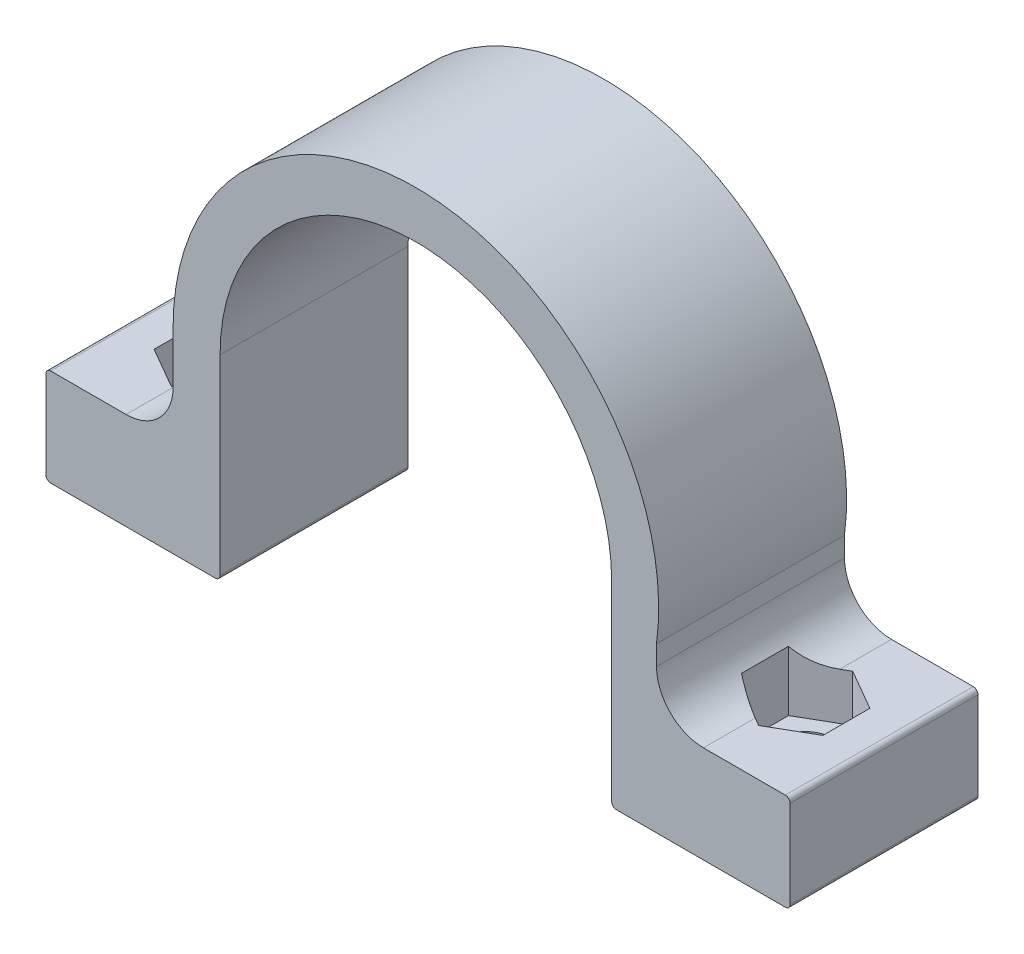
from build123d import *

# Parameters (mm, degrees)
BOSS_EXTRUDE1_DEPTH = 12
SKETCH2_R           = 1.65
CUT_EXTRUDE1_DEPTH  = 35.49487292
CUT_EXTRUDE2_DEPTH  = 3
FILLET2_R           = 3
FILLET3_R           = 0.3


with BuildPart() as part:
    # Sketch1 → Boss-Extrude1 (new body)
    with BuildSketch(Plane.XY):
        with BuildLine():
            Line((-12.5, -12.5), (-12.5, 0))
            ThreePointArc((-12.5, 0), (0, 12.5), (12.5, 0))
            Line((12.5, 0), (12.5, -12.5))
            Line((12.5, -12.5), (23.888412626, -12.5))
            Line((23.888412626, -12.5), (23.888412626, -6.3))
            Line((23.888412626, -6.3), (15.363999686, -6.3))
            Line((15.363999686, -6.3), (15.363999686, -2.048783456))
            ThreePointArc((15.363999686, -2.048783456), (1.026646207, 15.465962549), (-15.5, 0))
            Line((-15.5, 0), (-15.5, -6.3))
            Line((-15.5, -6.3), (-23.612861565, -6.3))
            Line((-23.612861565, -6.3), (-23.612861565, -12.5))
            Line((-23.612861565, -12.5), (-12.5, -12.5))
        make_face()
    extrude(amount=BOSS_EXTRUDE1_DEPTH)

    # Sketch2 → Cut-Extrude1 (cut, through all)
    with BuildSketch(Plane(origin=(0, -6.3, 0), x_dir=(1, 0, 0), z_dir=(0, 1, 0))):
        with Locations(Location((-18.612861565, -6, 0), (0, 0, 180))):
            Circle(SKETCH2_R)
        with Locations(Location((18.888412626, -6, 0), (0, 0, 180))):
            Circle(SKETCH2_R)
    extrude(amount=-CUT_EXTRUDE1_DEPTH, mode=Mode.SUBTRACT)

    # Sketch3 → Cut-Extrude2 (cut)
    with BuildSketch(Plane(origin=(0, -6.3, 0), x_dir=(1, 0, 0), z_dir=(0, 1, 0))):
        Polygon((18.888412626, -3), (16.290336415, -4.5), (16.290336415, -7.5), (18.888412626, -9), (21.486488837, -7.5), (21.486488837, -4.5), align=None)
        Polygon((-18.612861565, -9), (-16.014785354, -7.5), (-16.014785354, -4.5), (-18.612861565, -3), (-21.210937777, -4.5), (-21.210937777, -7.5), align=None)
    extrude(amount=-CUT_EXTRUDE2_DEPTH, mode=Mode.SUBTRACT)

    # Fillet2
    # the kernel refuses this fillet: 3 mm, written as the material it adds along each edge
    with BuildSketch(Plane(origin=(-15.5, -6.3, 0), x_dir=(0, 1, 0), z_dir=(0, 0, 1))) as fillet2_piece_1_section:
        with BuildLine():
            CenterArc((FILLET2_R, FILLET2_R), FILLET2_R, 180, 90)
            Line((0, FILLET2_R), (0, 0))
            Line((0, 0), (FILLET2_R, 0))
        make_face()
    fillet2_piece_1 = extrude(amount=12, mode=Mode.PRIVATE)
    fillet2_piece_1 = split(fillet2_piece_1, bisect_by=Plane(origin=(-16.699597169, -5.271939642, 4.104623714), z_dir=(0.5000000000000008, 0, -0.8660254037844383)), keep=Keep.TOP, mode=Mode.PRIVATE)
    fillet2_piece_1 = split(fillet2_piece_1, bisect_by=Plane(origin=(-16.014785354, -5.271939642, 2.345499265), z_dir=(1, 0, 0)), keep=Keep.TOP, mode=Mode.PRIVATE)
    add(fillet2_piece_1)
    with BuildSketch(Plane(origin=(-15.5, -6.3, 0), x_dir=(0, 1, 0), z_dir=(0, 0, 1))) as fillet2_piece_2_section:
        with BuildLine():
            CenterArc((FILLET2_R, FILLET2_R), FILLET2_R, 180, 90)
            Line((0, FILLET2_R), (0, 0))
            Line((0, 0), (FILLET2_R, 0))
        make_face()
    fillet2_piece_2 = extrude(amount=12, mode=Mode.PRIVATE)
    fillet2_piece_2 = split(fillet2_piece_2, bisect_by=Plane(origin=(-17.543441621, -5.964994309, 3.617429893), z_dir=(0.5000000000000008, 0, -0.8660254037844383)), keep=Keep.TOP, mode=Mode.PRIVATE)
    fillet2_piece_2 = split(fillet2_piece_2, bisect_by=Plane(origin=(-16.014785354, -5.964994309, 2.067102796), z_dir=(-1, 0, 0)), keep=Keep.TOP, mode=Mode.PRIVATE)
    add(fillet2_piece_2)
    with BuildSketch(Plane(origin=(-15.5, -6.3, 0), x_dir=(0, 1, 0), z_dir=(0, 0, 1))) as fillet2_piece_3_section:
        with BuildLine():
            CenterArc((FILLET2_R, FILLET2_R), FILLET2_R, 180, 90)
            Line((0, FILLET2_R), (0, 0))
            Line((0, 0), (FILLET2_R, 0))
        make_face()
    fillet2_piece_3 = extrude(amount=12, mode=Mode.PRIVATE)
    fillet2_piece_3 = split(fillet2_piece_3, bisect_by=Plane(origin=(-15.128726527, -5.296162819, 5.011566302), z_dir=(-0.5000000000000008, 0, 0.8660254037844383)), keep=Keep.TOP, mode=Mode.PRIVATE)
    fillet2_piece_3 = split(fillet2_piece_3, bisect_by=Plane(origin=(-16.014785354, -5.296162819, 6), z_dir=(1, 0, 0)), keep=Keep.TOP, mode=Mode.PRIVATE)
    fillet2_piece_3 = split(fillet2_piece_3, bisect_by=Plane(origin=(-15.128726527, -5.296162819, 6.988433698), z_dir=(-0.49999999999999994, 0, -0.8660254037844389)), keep=Keep.TOP, mode=Mode.PRIVATE)
    add(fillet2_piece_3)
    with BuildSketch(Plane(origin=(-15.5, -6.3, 0), x_dir=(0, 1, 0), z_dir=(0, 0, 1))) as fillet2_piece_4_section:
        with BuildLine():
            CenterArc((FILLET2_R, FILLET2_R), FILLET2_R, 180, 90)
            Line((0, FILLET2_R), (0, 0))
            Line((0, 0), (FILLET2_R, 0))
        make_face()
    fillet2_piece_4 = extrude(amount=12, mode=Mode.PRIVATE)
    fillet2_piece_4 = split(fillet2_piece_4, bisect_by=Plane(origin=(-16.014785354, -5.271939642, 9.654500735), z_dir=(1, 0, 0)), keep=Keep.TOP, mode=Mode.PRIVATE)
    fillet2_piece_4 = split(fillet2_piece_4, bisect_by=Plane(origin=(-16.699597169, -5.271939642, 7.895376286), z_dir=(0.49999999999999994, 0, 0.8660254037844389)), keep=Keep.TOP, mode=Mode.PRIVATE)
    add(fillet2_piece_4)
    with BuildSketch(Plane(origin=(-15.5, -6.3, 0), x_dir=(0, 1, 0), z_dir=(0, 0, 1))) as fillet2_piece_5_section:
        with BuildLine():
            CenterArc((FILLET2_R, FILLET2_R), FILLET2_R, 180, 90)
            Line((0, FILLET2_R), (0, 0))
            Line((0, 0), (FILLET2_R, 0))
        make_face()
    fillet2_piece_5 = extrude(amount=12, mode=Mode.PRIVATE)
    fillet2_piece_5 = split(fillet2_piece_5, bisect_by=Plane(origin=(-16.014785354, -5.964994309, 9.932897204), z_dir=(-1, 0, 0)), keep=Keep.TOP, mode=Mode.PRIVATE)
    fillet2_piece_5 = split(fillet2_piece_5, bisect_by=Plane(origin=(-17.543441621, -5.964994309, 8.382570107), z_dir=(0.49999999999999994, 0, 0.8660254037844389)), keep=Keep.TOP, mode=Mode.PRIVATE)
    add(fillet2_piece_5)
    with BuildSketch(Plane(origin=(15.363999686, -6.3, 0), x_dir=(0, 1, 0), z_dir=(0, 0, 1))) as fillet2_piece_6_section:
        with BuildLine():
            CenterArc((FILLET2_R, -FILLET2_R), FILLET2_R, 90, 90)
            Line((0, -FILLET2_R), (0, 0))
            Line((0, 0), (FILLET2_R, 0))
        make_face()
    fillet2_piece_6 = extrude(amount=12, mode=Mode.PRIVATE)
    fillet2_piece_6 = split(fillet2_piece_6, bisect_by=Plane(origin=(16.290336415, -5.412045629, 2.423810939), z_dir=(-1, 0, 0)), keep=Keep.TOP, mode=Mode.PRIVATE)
    fillet2_piece_6 = split(fillet2_piece_6, bisect_by=Plane(origin=(16.737778584, -5.412045629, 4.241669143), z_dir=(-0.4999999999999997, 0, -0.866025403784439)), keep=Keep.TOP, mode=Mode.PRIVATE)
    add(fillet2_piece_6)
    with BuildSketch(Plane(origin=(15.363999686, -6.3, 0), x_dir=(0, 1, 0), z_dir=(0, 0, 1))) as fillet2_piece_7_section:
        with BuildLine():
            CenterArc((FILLET2_R, -FILLET2_R), FILLET2_R, 90, 90)
            Line((0, -FILLET2_R), (0, 0))
            Line((0, 0), (FILLET2_R, 0))
        make_face()
    fillet2_piece_7 = extrude(amount=12, mode=Mode.PRIVATE)
    fillet2_piece_7 = split(fillet2_piece_7, bisect_by=Plane(origin=(16.290336415, -6.100859955, 2.085482464), z_dir=(1, 0, 0)), keep=Keep.TOP, mode=Mode.PRIVATE)
    fillet2_piece_7 = split(fillet2_piece_7, bisect_by=Plane(origin=(17.763282274, -6.100859955, 3.649594312), z_dir=(-0.4999999999999997, 0, -0.866025403784439)), keep=Keep.TOP, mode=Mode.PRIVATE)
    add(fillet2_piece_7)
    with BuildSketch(Plane(origin=(15.363999686, -6.3, 0), x_dir=(0, 1, 0), z_dir=(0, 0, 1))) as fillet2_piece_8_section:
        with BuildLine():
            CenterArc((FILLET2_R, -FILLET2_R), FILLET2_R, 90, 90)
            Line((0, -FILLET2_R), (0, 0))
            Line((0, 0), (FILLET2_R, 0))
        make_face()
    fillet2_piece_8 = extrude(amount=12, mode=Mode.PRIVATE)
    fillet2_piece_8 = split(fillet2_piece_8, bisect_by=Plane(origin=(15.225397876, -5.465952717, 6.885157448), z_dir=(0.5000000000000012, 0, -0.866025403784438)), keep=Keep.TOP, mode=Mode.PRIVATE)
    fillet2_piece_8 = split(fillet2_piece_8, bisect_by=Plane(origin=(16.290336415, -5.465952717, 6), z_dir=(-1, 0, 0)), keep=Keep.TOP, mode=Mode.PRIVATE)
    fillet2_piece_8 = split(fillet2_piece_8, bisect_by=Plane(origin=(15.225397876, -5.465952717, 5.114842552), z_dir=(0.4999999999999997, 0, 0.866025403784439)), keep=Keep.TOP, mode=Mode.PRIVATE)
    add(fillet2_piece_8)
    with BuildSketch(Plane(origin=(15.363999686, -6.3, 0), x_dir=(0, 1, 0), z_dir=(0, 0, 1))) as fillet2_piece_9_section:
        with BuildLine():
            CenterArc((FILLET2_R, -FILLET2_R), FILLET2_R, 90, 90)
            Line((0, -FILLET2_R), (0, 0))
            Line((0, 0), (FILLET2_R, 0))
        make_face()
    fillet2_piece_9 = extrude(amount=12, mode=Mode.PRIVATE)
    fillet2_piece_9 = split(fillet2_piece_9, bisect_by=Plane(origin=(16.737778584, -5.412045629, 7.758330857), z_dir=(-0.5000000000000012, 0, 0.866025403784438)), keep=Keep.TOP, mode=Mode.PRIVATE)
    fillet2_piece_9 = split(fillet2_piece_9, bisect_by=Plane(origin=(16.290336415, -5.412045629, 9.576189061), z_dir=(-1, 0, 0)), keep=Keep.TOP, mode=Mode.PRIVATE)
    add(fillet2_piece_9)
    with BuildSketch(Plane(origin=(15.363999686, -6.3, 0), x_dir=(0, 1, 0), z_dir=(0, 0, 1))) as fillet2_piece_10_section:
        with BuildLine():
            CenterArc((FILLET2_R, -FILLET2_R), FILLET2_R, 90, 90)
            Line((0, -FILLET2_R), (0, 0))
            Line((0, 0), (FILLET2_R, 0))
        make_face()
    fillet2_piece_10 = extrude(amount=12, mode=Mode.PRIVATE)
    fillet2_piece_10 = split(fillet2_piece_10, bisect_by=Plane(origin=(17.763282274, -6.100859955, 8.350405688), z_dir=(-0.5000000000000012, 0, 0.866025403784438)), keep=Keep.TOP, mode=Mode.PRIVATE)
    fillet2_piece_10 = split(fillet2_piece_10, bisect_by=Plane(origin=(16.290336415, -6.100859955, 9.914517536), z_dir=(1, 0, 0)), keep=Keep.TOP, mode=Mode.PRIVATE)
    add(fillet2_piece_10)

    # Fillet3
    fillet3_edges = [part.edges().sort_by_distance(p)[0] for p in [
        (23.888412626, -6.3, 6),
        (23.888412626, -12.5, 6),
        (12.5, -12.5, 6),
        (-12.5, -12.5, 6),
        (-23.612861565, -12.5, 6),
        (-23.612861565, -6.3, 6),
    ]]
    fillet(fillet3_edges, radius=FILLET3_R)


solid = part.part
